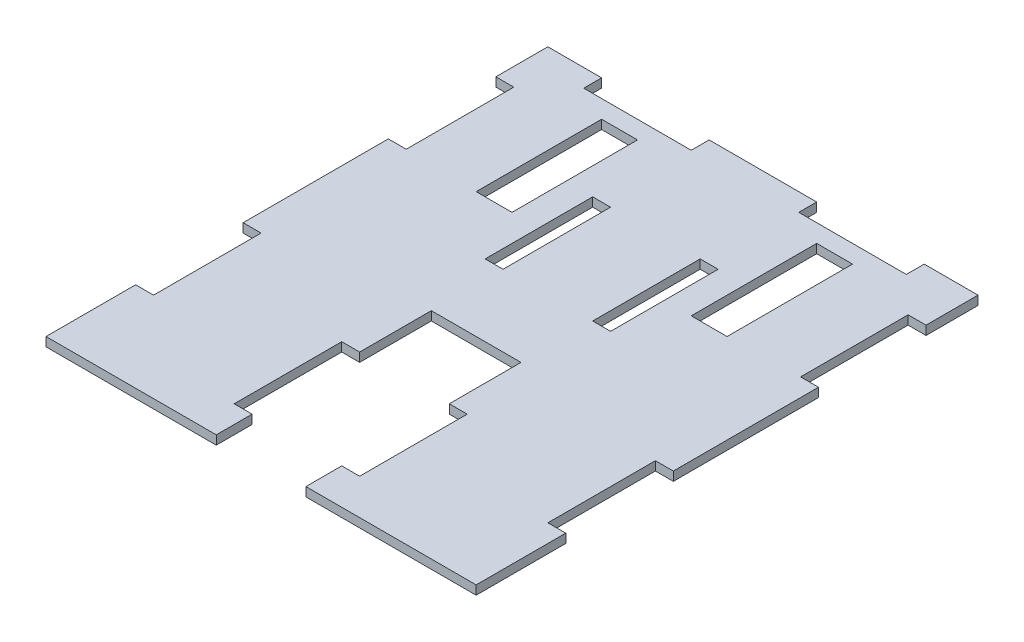
from build123d import *

# Parameters (mm, degrees)
SKETCH1_W           = 304.8
SKETCH1_H           = 355.6
BOSS_EXTRUDE1_DEPTH = 6.35
SKETCH2_W           = 63.5
SKETCH2_H           = 152.4
CUT_EXTRUDE1_DEPTH  = 235.26250767
SKETCH3_W           = 25.4
SKETCH3_H           = 88.9
CUT_EXTRUDE2_DEPTH  = 235.26250767
SKETCH4_W           = 12.7
SKETCH4_H           = 76.2
SKETCH4_W_2         = 76.2
SKETCH4_H_2         = 12.7
CUT_EXTRUDE3_DEPTH  = 235.26250767


with BuildPart() as part:
    # Sketch1 → Boss-Extrude1 (new body)
    with BuildSketch(Plane(origin=(0, 0, 0), x_dir=(1, 0, 0), z_dir=(0, 1, 0))):
        Rectangle(SKETCH1_W, SKETCH1_H)
    extrude(amount=BOSS_EXTRUDE1_DEPTH)

    # Sketch2 → Cut-Extrude1 (cut, through all)
    with BuildSketch(Plane(origin=(0, 6.35, 0), x_dir=(1, 0, 0), z_dir=(0, 1, 0))):
        with Locations((0, -101.6)):
            Rectangle(SKETCH2_W, SKETCH2_H)
    extrude(amount=-CUT_EXTRUDE1_DEPTH, mode=Mode.SUBTRACT)

    # Sketch3 → Cut-Extrude2 (cut, through all)
    with BuildSketch(Plane(origin=(0, 6.35, 0), x_dir=(1, 0, 0), z_dir=(0, 1, 0))):
        with Locations((76.2, 107.95)):
            Rectangle(SKETCH3_W, SKETCH3_H)
        with Locations((-76.2, 107.95)):
            Rectangle(SKETCH3_W, SKETCH3_H)
    extrude(amount=-CUT_EXTRUDE2_DEPTH, mode=Mode.SUBTRACT)

    # Sketch4 → Cut-Extrude3 (cut, through all)
    with BuildSketch(Plane(origin=(0, 6.35, 0), x_dir=(1, 0, 0), z_dir=(0, 1, 0))):
        with Locations((-146.05, 102.87)):
            Rectangle(SKETCH4_W, SKETCH4_H)
        with Locations((-146.05, -76.2)):
            Rectangle(SKETCH4_W, SKETCH4_H)
        with Locations((146.05, 102.87)):
            Rectangle(SKETCH4_W, SKETCH4_H)
        with Locations((146.05, -76.2)):
            Rectangle(SKETCH4_W, SKETCH4_H)
        with Locations((76.2, 171.45)):
            Rectangle(SKETCH4_W_2, SKETCH4_H_2)
        with Locations((-76.2, 171.45)):
            Rectangle(SKETCH4_W_2, SKETCH4_H_2)
        with Locations((-38.1, -114.3)):
            Rectangle(SKETCH4_W, SKETCH4_H)
        with Locations((38.1, 63.5)):
            Rectangle(SKETCH4_W, SKETCH4_H)
        with Locations((-38.1, 63.5)):
            Rectangle(SKETCH4_W, SKETCH4_H)
        with Locations((38.1, -114.3)):
            Rectangle(SKETCH4_W, SKETCH4_H)
    extrude(amount=-CUT_EXTRUDE3_DEPTH, mode=Mode.SUBTRACT)


solid = part.part
